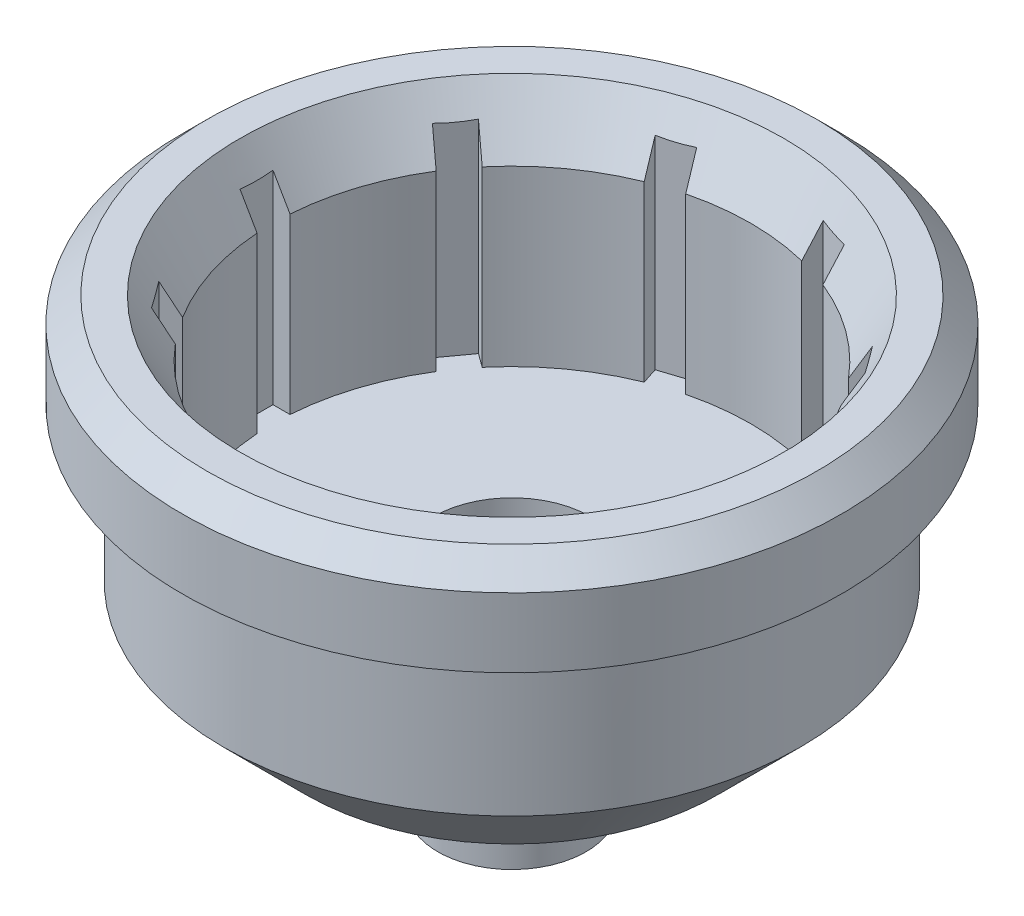
from build123d import *

# Parameters (mm, degrees)
CHAMFER1_SIZE      = 2
CHAMFER1_SIZE2     = 3.464101615
CHAMFER2_SIZE      = 1.5
SKETCH2_W          = 31
SKETCH2_H          = 2
CUT_EXTRUDE1_DEPTH = 32.559467676
CIRPATTERN1_COUNT  = 10
CHAMFER3_SIZE      = 5


with BuildPart() as part:
    # Sketch1 → Revolve1 (revolve)
    with BuildSketch(Plane.XY):
        Polygon((-2.5, 0), (-2.5, 9), (-4.75, 9), (-4.75, 13), (-14.5, 13), (-14.5, 27), (-20, 27), (-20, 21.3), (-17.5, 21.3), (-17.5, 7), (-6.5, 7), (-6.5, 6), (-4.5, 6), (-4.5, 0), align=None)
    revolve(axis=Axis((0, 0, 0), (0, 1, 0)))

    # Chamfer1
    chamfer1_edges = [part.edges().sort_by_distance(p)[0] for p in [
        (14.5, 27, 0),
    ]]
    chamfer1_side = [part.faces().sort_by_distance(p)[0] for p in [
        (15.065685425, 27, 0),
    ]]
    chamfer(chamfer1_edges, length=CHAMFER1_SIZE, length2=CHAMFER1_SIZE2, reference=chamfer1_side[0])

    # Chamfer2
    chamfer2_edges = [part.edges().sort_by_distance(p)[0] for p in [
        (20, 27, 0),
    ]]
    chamfer(chamfer2_edges, length=CHAMFER2_SIZE)

    # Sketch2 → Cut-Extrude1 (cut, through all)
    with BuildSketch(Plane(origin=(0, 13, 0), x_dir=(1, 0, 0), z_dir=(0, 1, 0))):
        Rectangle(SKETCH2_W, SKETCH2_H)
    cut_extrude1 = extrude(amount=CUT_EXTRUDE1_DEPTH, mode=Mode.SUBTRACT)

    # CirPattern1: Cut-Extrude1 ×10 about axis
    cirpattern1_axis = Axis((0, 13, 0), (0, -1, 0))
    for i in range(1, CIRPATTERN1_COUNT):
        add(cut_extrude1.rotate(cirpattern1_axis, i * 360 / CIRPATTERN1_COUNT), mode=Mode.SUBTRACT)

    # Chamfer3
    chamfer3_edges = [part.edges().sort_by_distance(p)[0] for p in [
        (17.5, 7, 0),
    ]]
    chamfer(chamfer3_edges, length=CHAMFER3_SIZE)


solid = part.part
